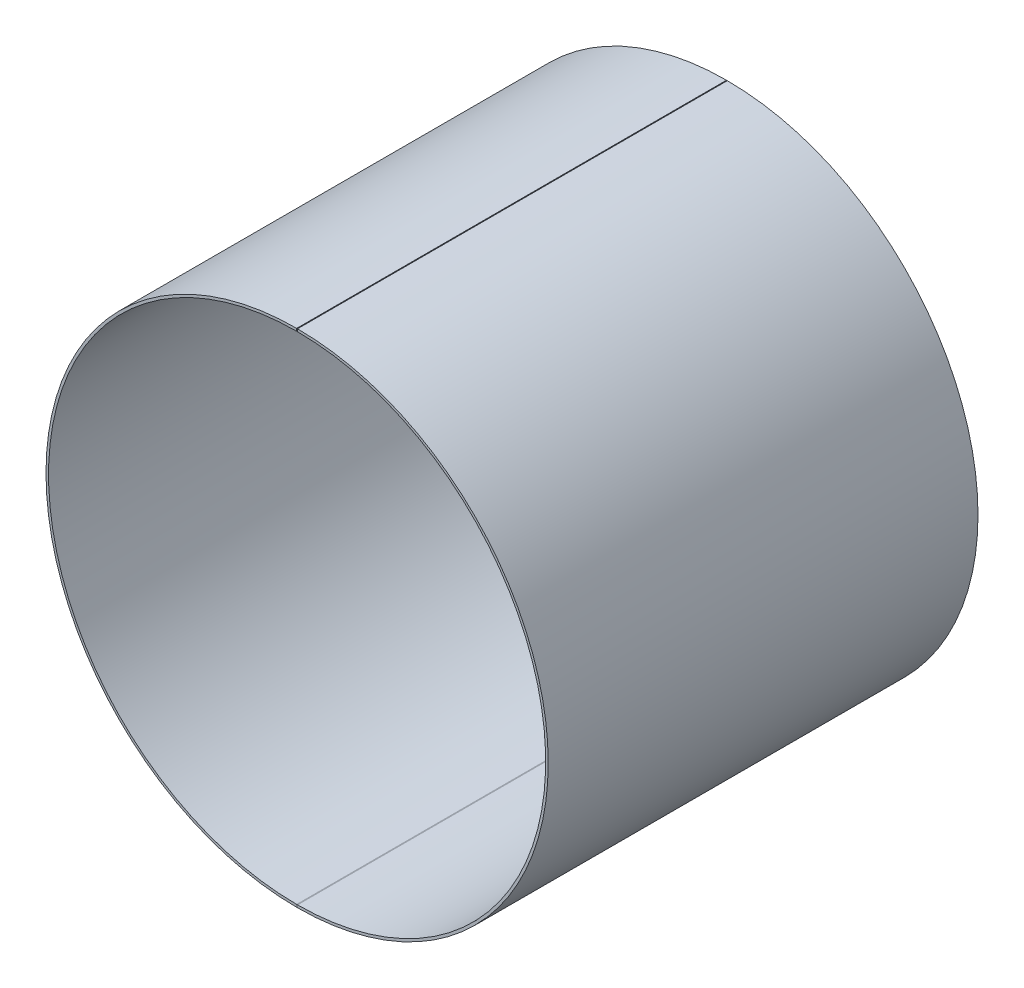
from build123d import *

# Parameters (mm, degrees)
BASE_FLANGE1_DEPTH = 266.7


# Sheet-metal steps are written as plain solids
with BuildPart() as part:
    # Sketch1 → Base-Flange1 (new body)
    with BuildSketch(Plane.XY):
        with BuildLine():
            ThreePointArc((-0.254, 154), (-154.254, 0), (-0.254, -154))
            Line((-0.254, -154), (0.254, -154))
            ThreePointArc((0.254, -154), (154.254, 0), (0.254, 154))
            Line((0.254, 154), (0.254, 155.5748))
            ThreePointArc((0.254, 155.5748), (155.8288, 0), (0.254, -155.5748))
            Line((0.254, -155.5748), (-0.254, -155.5748))
            ThreePointArc((-0.254, -155.5748), (-155.8288, 0), (-0.254, 155.5748))
            Line((-0.254, 155.5748), (-0.254, 154))
        make_face()
    extrude(amount=BASE_FLANGE1_DEPTH)


solid = part.part
